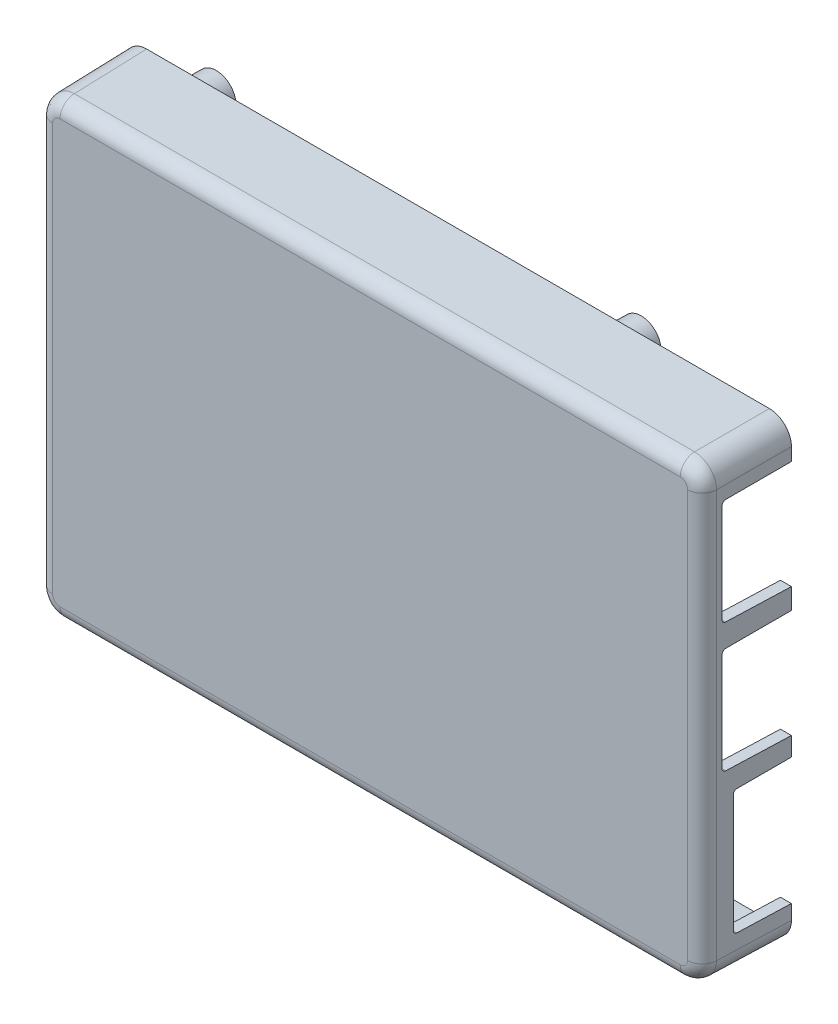
from build123d import *

# Parameters (mm, degrees)
SKETCH1_W                    = 91
SKETCH1_H                    = 62
SKETCH1_W_2                  = 88
SKETCH1_H_2                  = 59
WALLS_DEPTH                  = 12
SKETCH2_W                    = 91
SKETCH2_H                    = 62
BASE_DEPTH                   = 1.5
SKETCH3_R                    = 3
STANDOFFS_DEPTH              = 16.5
STANDOFFS_DRAFT              = 1
STANDOFFS_PROFILE_2_DEPTH    = 16.5
STANDOFFS_PROFILE_2_DRAFT    = 1
STANDOFFS_PROFILE_3_DEPTH    = 16.5
STANDOFFS_PROFILE_3_DRAFT    = 1
STANDOFFS_PROFILE_4_DEPTH    = 16.5
STANDOFFS_PROFILE_4_DRAFT    = 1
M2X0_4_TAPPED_HOLE1_D        = 1.6
M2X0_4_TAPPED_HOLE1_DEPTH    = 5
M2X0_4_TAPPED_HOLE1_TIP      = 0.480688495
USB_START                    = 30
SKETCH6_W                    = 14.2
SKETCH6_H                    = 17.304
SKETCH6_W_2                  = 16.490000002
SKETCH6_H_2                  = 14.78
USB_AND_ETHERNET_PORTS_DEPTH = 27.349356695
DRAFT1_ANGLE                 = -1
DRAFT2_ANGLE                 = 1
FILLET1_R                    = 3
FILLET2_R                    = 1.5
FILLET3_R                    = 2
FILLET4_R                    = 0.5
DRAFT3_ANGLE                 = 1
FILLET5_R                    = 0.5


with BuildPart() as part:
    # Sketch1 → Walls (new body)
    with BuildSketch(Plane.XY):
        Rectangle(SKETCH1_W, SKETCH1_H)
        Rectangle(SKETCH1_W_2, SKETCH1_H_2, mode=Mode.SUBTRACT)
    extrude(amount=WALLS_DEPTH)

    # Sketch2 → Base (add)
    with BuildSketch(Plane.XY.offset(12)):
        Rectangle(SKETCH2_W, SKETCH2_H)
    extrude(amount=-BASE_DEPTH)


with BuildPart() as standoffs_tool:
    # Sketch3 → Standoffs (with draft: the straight prism first)
    with BuildSketch(Plane(origin=(0, 0, 10.5), x_dir=(-1, 0, 0), z_dir=(0, 0, -1))):
        with Locations((39, -24.5)):
            Circle(SKETCH3_R)
    extrude(amount=STANDOFFS_DEPTH)
    # Standoffs: the draft: its side faces are tilted about the plane it starts from
    standoffs_sides = [standoffs_tool.faces().sort_by_distance(p)[0] for p in [
        (-36, -24.5, 2.25),
    ]]
    draft(standoffs_sides, Plane(origin=(0, 0, 10.5), x_dir=(-1, 0, 0), z_dir=(0, 0, -1)), STANDOFFS_DRAFT)


with BuildPart() as part_1:
    add(part.part)

    # Standoffs: add standoffs_tool
    add(standoffs_tool.part)


with BuildPart() as standoffs_profile_2_tool:
    # Sketch3 → Standoffs profile 2 (with draft: the straight prism first)
    with BuildSketch(Plane(origin=(0, 0, 10.5), x_dir=(-1, 0, 0), z_dir=(0, 0, -1))):
        with Locations((-19, -24.5)):
            Circle(SKETCH3_R)
    extrude(amount=STANDOFFS_PROFILE_2_DEPTH)
    # Standoffs profile 2: the draft: its side faces are tilted about the plane it starts from
    standoffs_profile_2_sides = [standoffs_profile_2_tool.faces().sort_by_distance(p)[0] for p in [
        (22, -24.5, 2.25),
    ]]
    draft(standoffs_profile_2_sides, Plane(origin=(0, 0, 10.5), x_dir=(-1, 0, 0), z_dir=(0, 0, -1)), STANDOFFS_PROFILE_2_DRAFT)


with BuildPart() as part_2:
    add(part_1.part)

    # Standoffs profile 2: add standoffs_profile_2_tool
    add(standoffs_profile_2_tool.part)


with BuildPart() as standoffs_profile_3_tool:
    # Sketch3 → Standoffs profile 3 (with draft: the straight prism first)
    with BuildSketch(Plane(origin=(0, 0, 10.5), x_dir=(-1, 0, 0), z_dir=(0, 0, -1))):
        with Locations((-19, 24.5)):
            Circle(SKETCH3_R)
    extrude(amount=STANDOFFS_PROFILE_3_DEPTH)
    # Standoffs profile 3: the draft: its side faces are tilted about the plane it starts from
    standoffs_profile_3_sides = [standoffs_profile_3_tool.faces().sort_by_distance(p)[0] for p in [
        (22, 24.5, 2.25),
    ]]
    draft(standoffs_profile_3_sides, Plane(origin=(0, 0, 10.5), x_dir=(-1, 0, 0), z_dir=(0, 0, -1)), STANDOFFS_PROFILE_3_DRAFT)


with BuildPart() as part_3:
    add(part_2.part)

    # Standoffs profile 3: add standoffs_profile_3_tool
    add(standoffs_profile_3_tool.part)


with BuildPart() as standoffs_profile_4_tool:
    # Sketch3 → Standoffs profile 4 (with draft: the straight prism first)
    with BuildSketch(Plane(origin=(0, 0, 10.5), x_dir=(-1, 0, 0), z_dir=(0, 0, -1))):
        with Locations((39, 24.5)):
            Circle(SKETCH3_R)
    extrude(amount=STANDOFFS_PROFILE_4_DEPTH)
    # Standoffs profile 4: the draft: its side faces are tilted about the plane it starts from
    standoffs_profile_4_sides = [standoffs_profile_4_tool.faces().sort_by_distance(p)[0] for p in [
        (-36, 24.5, 2.25),
    ]]
    draft(standoffs_profile_4_sides, Plane(origin=(0, 0, 10.5), x_dir=(-1, 0, 0), z_dir=(0, 0, -1)), STANDOFFS_PROFILE_4_DRAFT)


with BuildPart() as part_4:
    add(part_3.part)

    # Standoffs profile 4: add standoffs_profile_4_tool
    add(standoffs_profile_4_tool.part)

    # M2x0.4 Tapped Hole1
    with Locations(Plane(origin=(0, 0, -6), x_dir=(-1, 0, 0), z_dir=(0, 0, -1))):
        with Locations((39, -24.5), (-19, -24.5), (-19, 24.5), (39, 24.5)):
            Hole(M2X0_4_TAPPED_HOLE1_D / 2, depth=M2X0_4_TAPPED_HOLE1_DEPTH)
            with Locations((0, 0, -(M2X0_4_TAPPED_HOLE1_DEPTH + M2X0_4_TAPPED_HOLE1_TIP / 2))):  # 118° drill point
                Cone(0, M2X0_4_TAPPED_HOLE1_D / 2, M2X0_4_TAPPED_HOLE1_TIP, mode=Mode.SUBTRACT)

    # Sketch6 → USB and Ethernet Ports (cut, through all)
    with BuildSketch(Plane(origin=(0, 0, 0), x_dir=(0, 0, -1), z_dir=(1, 0, 0)).offset(USB_START)):
        with Locations((-0.7, -17.348)):
            Rectangle(SKETCH6_W, SKETCH6_H)
        with Locations((-1.054999999, 1.25)):
            Rectangle(SKETCH6_W_2, SKETCH6_H_2)
        with Locations((-1.054999999, 18.85)):
            Rectangle(SKETCH6_W_2, SKETCH6_H_2)
    extrude(amount=USB_AND_ETHERNET_PORTS_DEPTH, mode=Mode.SUBTRACT)

    # Draft1
    draft1_faces = [part_4.faces().sort_by_distance(p)[0] for p in [
        (45.5, -28.5, 0.631506136),
        (0, -31, 6),
        (-45.5, 0, 6),
        (0, 31, 6),
    ]]
    draft(draft1_faces, Plane(origin=(0, 0, 0), x_dir=(-1, 0, 0), z_dir=(0, 0, -1)), DRAFT1_ANGLE)

    # Draft2
    draft2_faces = [part_4.faces().sort_by_distance(p)[0] for p in [
        (44, -27.75, 0.59927039),
        (0, -29.5, 5.25),
        (-44, 0, 5.25),
        (0, 29.5, 5.25),
    ]]
    draft(draft2_faces, Plane(origin=(0, 0, 0), x_dir=(-1, 0, 0), z_dir=(0, 0, -1)), DRAFT2_ANGLE)

    # Fillet1
    fillet1_edges = [part_4.edges().sort_by_distance(p)[0] for p in [
        (-45.39526961, 30.89526961, 6),
        (45.39526961, -30.89526961, 6),
        (45.39526961, 30.89526961, 6),
        (-45.39526961, -30.89526961, 6),
    ]]
    fillet(fillet1_edges, radius=FILLET1_R)

    # Fillet2
    fillet2_edges = [part_4.edges().sort_by_distance(p)[0] for p in [
        (-43.908360909, 29.408360909, 5.25),
        (43.908360909, -29.408360909, 5.25),
        (43.908360909, 29.408360909, 5.25),
        (-43.908360909, -29.408360909, 5.25),
    ]]
    fillet(fillet2_edges, radius=FILLET2_R)

    # Fillet3
    fillet3_edges = [part_4.edges().sort_by_distance(p)[0] for p in [
        (44.412048804, 29.912048804, 12),
        (45.290539221, 0, 12),
        (44.412048804, -29.912048804, 12),
        (0, -30.790539221, 12),
        (-44.412048804, -29.912048804, 12),
        (-45.290539221, 0, 12),
        (-44.412048804, 29.912048804, 12),
        (0, 30.790539221, 12),
    ]]
    fillet(fillet3_edges, radius=FILLET3_R)

    # Fillet4
    fillet4_edges = [part_4.edges().sort_by_distance(p)[0] for p in [
        (-43.37747661, -28.87747661, 10.5),
        (0, -29.316721818, 10.5),
        (43.37747661, -28.87747661, 10.5),
        (43.816721818, 0, 10.5),
        (43.37747661, 28.87747661, 10.5),
        (0, 29.316721818, 10.5),
        (-43.37747661, 28.87747661, 10.5),
        (-43.816721818, 0, 10.5),
        (-36, -24.5, 10.5),
        (22, -24.5, 10.5),
        (22, 24.5, 10.5),
        (-36, 24.5, 10.5),
    ]]
    fillet(fillet4_edges, radius=FILLET4_R)

    # Draft3
    draft3_faces = [part_4.faces().sort_by_distance(p)[0] for p in [
        (44.681925247, -26, 3.9),
        (44.668833948, 11.46, 4.65),
        (44.668833948, -6.14, 4.65),
        (44.681925247, -8.696, 3.9),
        (44.668833948, 8.64, 4.65),
        (44.668833948, 26.24, 4.65),
    ]]
    draft(draft3_faces, Plane(origin=(0, 0, 0), x_dir=(-1, 0, 0), z_dir=(0, 0, -1)), DRAFT3_ANGLE)

    # Fillet5
    fillet5_edges = [part_4.edges().sort_by_distance(p)[0] for p in [
        (44.587667896, 11.622332104, 9.3),
        (44.587667896, -5.977667896, 9.3),
        (44.613850494, -25.863850494, 7.8),
        (44.613850494, -8.832149506, 7.8),
        (44.587667896, 8.477667896, 9.3),
        (44.587667896, 26.077667896, 9.3),
    ]]
    fillet(fillet5_edges, radius=FILLET5_R)


solid = part_4.part
